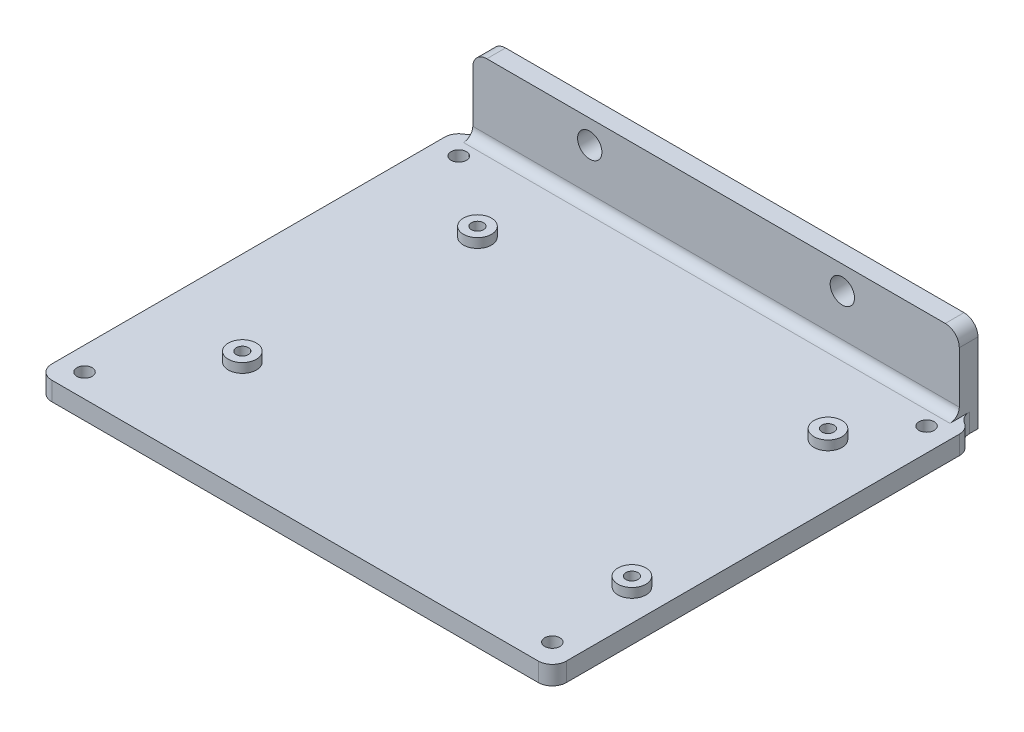
from build123d import *

# Parameters (mm, degrees)
BOSS_EXTRUDE1_DEPTH = 4
SKETCH2_R           = 3
BOSS_EXTRUDE2_DEPTH = 2
SKETCH3_R           = 1.3
CUT_EXTRUDE1_DEPTH  = 6
SKETCH4_R           = 2.6
BOSS_EXTRUDE3_DEPTH = 4
FILLET1_R           = 3
FILLET2_R           = 2
SKETCH5_R           = 1.625
CUT_EXTRUDE2_DEPTH  = 10


with BuildPart() as part:
    # Sketch1 → Boss-Extrude1 (new body)
    with BuildSketch(Plane(origin=(0, 0, 0), x_dir=(1, 0, 0), z_dir=(0, 1, 0))):
        with BuildLine():
            Line((3, 0), (107, 0))
            ThreePointArc((107, 0), (109.121320344, 0.878679656), (110, 3))
            Line((110, 3), (110, 87))
            ThreePointArc((110, 87), (109.121320344, 89.121320344), (107, 90))
            Line((107, 90), (3, 90))
            ThreePointArc((3, 90), (0.878679656, 89.121320344), (0, 87))
            Line((0, 87), (0, 3))
            ThreePointArc((0, 3), (0.878679656, 0.878679656), (3, 0))
        make_face()
    extrude(amount=BOSS_EXTRUDE1_DEPTH)

    # Sketch2 → Boss-Extrude2 (add)
    with BuildSketch(Plane(origin=(0, 4, 0), x_dir=(1, 0, 0), z_dir=(0, 1, 0))):
        with Locations(Location((22, 72, 0), (0, 0, 270))):
            Circle(SKETCH2_R)
        with Locations(Location((103.28, 23.74, 0), (0, 0, 270))):
            Circle(SKETCH2_R)
        with Locations(Location((96.93, 72, 0), (0, 0, 270))):
            Circle(SKETCH2_R)
        with Locations(Location((20, 23.74, 0), (0, 0, 270))):
            Circle(SKETCH2_R)
    extrude(amount=BOSS_EXTRUDE2_DEPTH)

    # Sketch3 → Cut-Extrude1 (cut)
    with BuildSketch(Plane(origin=(0, 6, 0), x_dir=(1, 0, 0), z_dir=(0, 1, 0))):
        with Locations(Location((22, 72, 0), (0, 0, 270))):
            Circle(SKETCH3_R)
        with Locations(Location((96.93, 72, 0), (0, 0, 270))):
            Circle(SKETCH3_R)
        with Locations(Location((103.28, 23.74, 0), (0, 0, 270))):
            Circle(SKETCH3_R)
        with Locations(Location((20, 23.74, 0), (0, 0, 270))):
            Circle(SKETCH3_R)
    extrude(amount=-CUT_EXTRUDE1_DEPTH, mode=Mode.SUBTRACT)

    # Sketch4 → Boss-Extrude3 (add)
    with BuildSketch(Plane(origin=(0, 0, -90), x_dir=(-1, 0, 0), z_dir=(0, 0, -1))):
        with BuildLine():
            Line((-107, 0), (-3, 0))
            Line((-3, 0), (-3, 17))
            ThreePointArc((-3, 17), (-3.878679656, 19.121320344), (-6, 20))
            Line((-6, 20), (-104, 20))
            ThreePointArc((-104, 20), (-106.121320344, 19.121320344), (-107, 17))
            Line((-107, 17), (-107, 0))
        make_face()
        with Locations((-82, 15)):
            Circle(SKETCH4_R, mode=Mode.SUBTRACT)
        with Locations((-28, 15)):
            Circle(SKETCH4_R, mode=Mode.SUBTRACT)
    extrude(amount=BOSS_EXTRUDE3_DEPTH)

    # Fillet1
    # the kernel refuses this fillet: 3 mm, written as the material it adds along each edge
    with BuildSketch(Plane(origin=(3, 0, -90), x_dir=(-0.9659258262890682, 0, 0.25881904510252113), z_dir=(0, 1, 0))) as fillet1_piece_1:
        with BuildLine():
            CenterArc((2.329371406, -2.897777479), FILLET1_R, 105, 60)
            Line((-0.568406073, -2.121320344), (0, 0))
            ThreePointArc((0, 0), (0.776457135, -0.102222521), (1.552914271, 0))
        make_face()
    extrude(amount=4)
    with BuildSketch(Plane(origin=(107, 0, -90), x_dir=(0.9659258262890682, 0, 0.2588190451025207), z_dir=(0, 1, 0))) as fillet1_piece_2:
        with BuildLine():
            CenterArc((2.329371406, 2.897777479), FILLET1_R, 195, 60)
            Line((-0.568406073, 2.121320344), (0, 0))
            ThreePointArc((0, 0), (0.776457135, 0.102222521), (1.552914271, 0))
        make_face()
    extrude(amount=4)

    # Fillet2
    fillet2_edges = [part.edges().sort_by_distance(p)[0] for p in [
        (55, 4, -90),
    ]]
    fillet(fillet2_edges, radius=FILLET2_R)

    # Sketch5 → Cut-Extrude2 (cut)
    with BuildSketch(Plane(origin=(0, 4, 0), x_dir=(1, 0, 0), z_dir=(0, 1, 0))):
        with Locations(Location((5, 85, 0), (0, 0, 270))):
            Circle(SKETCH5_R)
        with Locations(Location((105, 85, 0), (0, 0, 270))):
            Circle(SKETCH5_R)
        with Locations(Location((105, 5, 0), (0, 0, 270))):
            Circle(SKETCH5_R)
        with Locations(Location((5, 5, 0), (0, 0, 270))):
            Circle(SKETCH5_R)
    extrude(amount=-CUT_EXTRUDE2_DEPTH, mode=Mode.SUBTRACT)


solid = part.part
